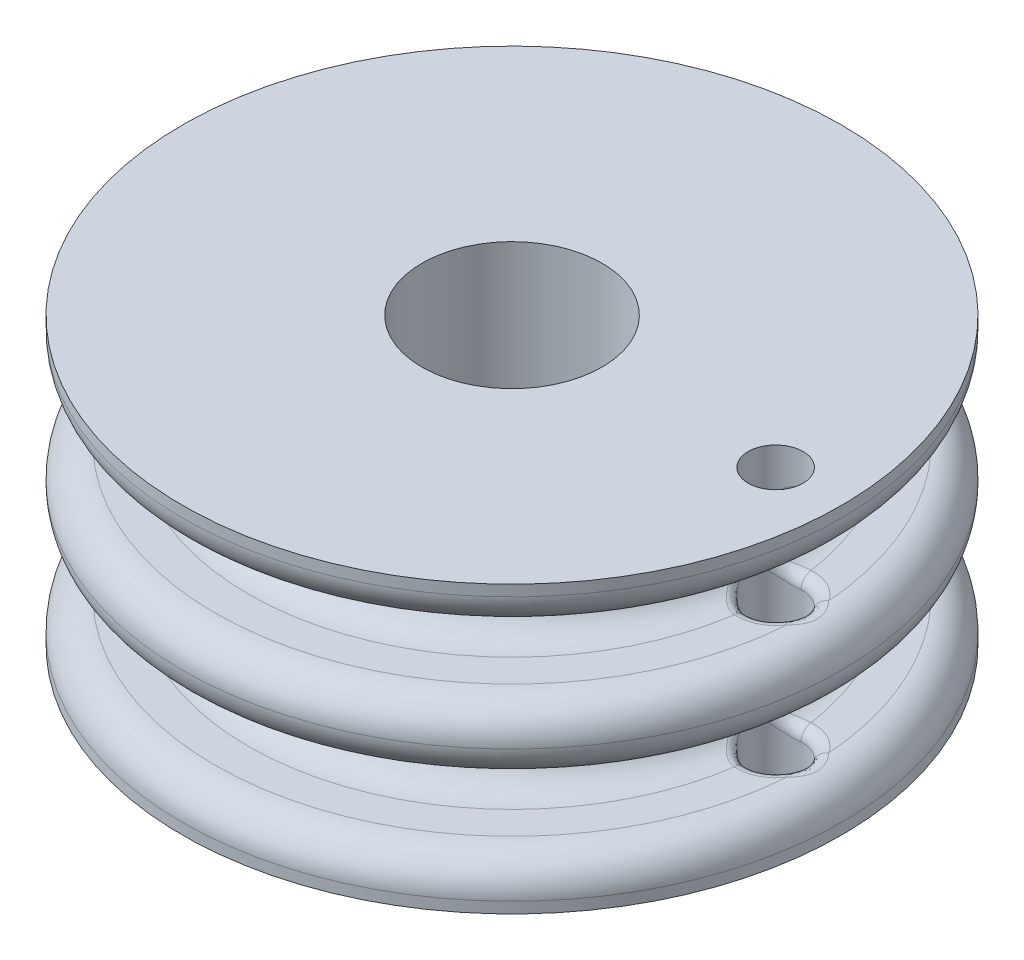
from build123d import *

# Parameters (mm, degrees)
CONG_1_R                = 1.5
ESQUISSE2_R             = 1.25
ESQUISSE2_R_2           = 4.1
ENL_V_MAT_EXTRU_1_DEPTH = 25.87971067
CONG_3_R                = 0.5


with BuildPart() as part:
    # Esquisse1 → Révolution1 (revolve)
    with BuildSketch(Plane.XY, mode=Mode.PRIVATE) as r_volution1_sk:
        with BuildLine():
            Line((0, 0), (0, 13))
            Line((0, 13), (15, 13))
            Line((15, 13), (15, 11))
            Line((15, 11), (12, 11))
            ThreePointArc((12, 11), (10.5, 9.5), (12, 8))
            Line((12, 8), (15, 8))
            Line((15, 8), (15, 5))
            Line((15, 5), (12, 5))
            ThreePointArc((12, 5), (10.5, 3.5), (12, 2))
            Line((12, 2), (15, 2))
            Line((15, 2), (15, 0))
            Line((15, 0), (0, 0))
        make_face()
    revolve(r_volution1_sk.sketch.rotate(Axis((0, 13, 0), (0, 1, 0)), 90), axis=Axis((0, 13, 0), (0, 1, 0)))

    # Congé1
    cong_1_edges = [part.edges().sort_by_distance(p)[0] for p in [
        (0, 8, 15),
        (0, 5, 15),
        (0, 2, 15),
        (0, 11, 15),
    ]]
    fillet(cong_1_edges, radius=CONG_1_R - 0.0001)  # a hair under: the kernel refuses the full size

    # Esquisse2 → Enlèv. mat.-Extru.1 (cut, through all)
    with BuildSketch(Plane(origin=(0, 13, 0), x_dir=(1, 0, 0), z_dir=(0, 1, 0))):
        with Locations(Location((12, 0, 0), (0, 0, 270))):
            Circle(ESQUISSE2_R)
        with Locations(Location((0, 0, 0), (0, 0, 270))):
            Circle(ESQUISSE2_R_2)
    extrude(amount=-ENL_V_MAT_EXTRU_1_DEPTH, mode=Mode.SUBTRACT)

    # Congé3
    cong_3_edges = [part.edges().sort_by_distance(p)[0] for p in [
        (13.249575785, 5, -0.032563134),
        (10.749999998, 4.329156219, 2e-09),
        (10.749999998, 2.670843781, -2e-09),
        (13.249575785, 2, -0.032563134),
        (13.249575785, 11, -0.032563134),
        (10.749999998, 10.329156219, 2e-09),
        (10.749999998, 8.670843781, -2e-09),
        (13.249575785, 8, -0.032563134),
    ]]
    fillet(cong_3_edges, radius=CONG_3_R)


solid = part.part
